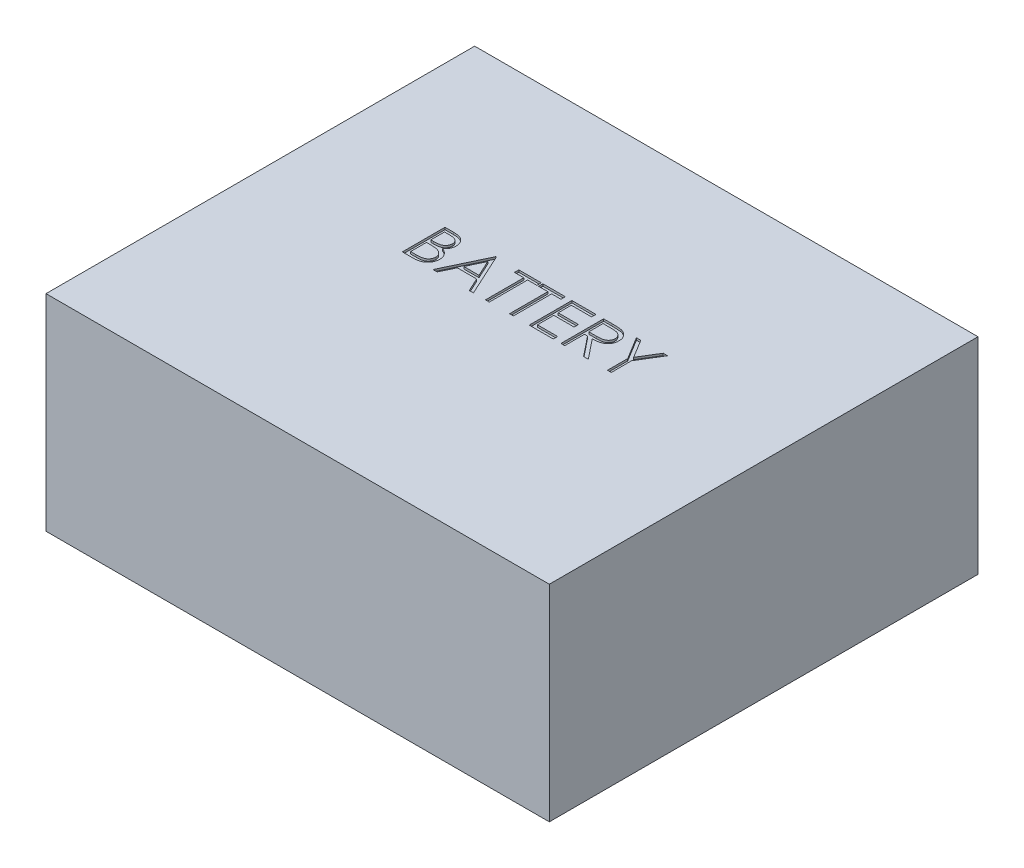
from build123d import *

# Parameters (mm, degrees)
SKETCH1_W           = 236
SKETCH1_H           = 201
BOSS_EXTRUDE1_DEPTH = 96.5
CUT_EXTRUDE1_DEPTH  = 1


with BuildPart() as part:
    # Sketch1 → Boss-Extrude1 (new body)
    with BuildSketch(Plane(origin=(0, 0, 0), x_dir=(1, 0, 0), z_dir=(0, 1, 0))):
        with Locations((118, 100.5)):
            Rectangle(SKETCH1_W, SKETCH1_H)
    extrude(amount=BOSS_EXTRUDE1_DEPTH)

    # Sketch2 → Cut-Extrude1 (cut)
    # profile 1 of 7: a face of its own
    with BuildSketch(Plane(origin=(0, 96.5, 0), x_dir=(1, 0, 0), z_dir=(0, 1, 0))):
        with BuildLine():
            Line((66.58974359, 120.5), (70.491987179, 120.5))
            add(Edge.make_bspline(
                [(70.491987179, 120.5), (70.683007055, 120.498995712), (71.053251114, 120.497049152), (71.591647924, 120.466859831), (72.095926842, 120.425696003), (72.566234113, 120.360381188), (73.002352412, 120.281571033), (73.405596054, 120.186132084), (73.774682752, 120.071694292), (74.21532696, 119.889715542), (74.717730737, 119.619297437), (75.261721552, 119.219705636), (75.726888634, 118.730948704), (76.127953304, 118.179619244), (76.446816845, 117.57312912), (76.677498544, 116.925933755), (76.823543546, 116.246380945), (76.83856317, 115.779848499), (76.846153846, 115.544070513)],
                knots=[0, 0, 0, 0, 1.001505555, 1.941167018, 2.826882275, 3.653841531, 4.429895133, 5.150066043, 5.825578002, 6.45369114, 7.647487171, 8.808567382, 9.977351308, 11.170798116, 12.373658725, 13.556498008, 14.765093433, 16, 16, 16, 16], degree=3))
            add(Edge.make_bspline(
                [(76.846153846, 115.544070513), (76.839906884, 115.323198766), (76.827631013, 114.889164955), (76.710243817, 114.254341473), (76.526468569, 113.650048794), (76.271010002, 113.078492306), (75.938998595, 112.552585945), (75.545522489, 112.068087282), (75.070797903, 111.645509813), (74.715122246, 111.409264656), (74.534455128, 111.289262821)],
                knots=[0, 0, 0, 0, 1.044552857, 2.05264487, 3.044412934, 4.028983338, 5.005914585, 5.980388656, 6.974128949, 8, 8, 8, 8], degree=3))
            add(Edge.make_bspline(
                [(74.534455128, 111.289262821), (74.761657572, 111.202034255), (75.196352128, 111.035144401), (75.794557913, 110.740084607), (76.309957028, 110.419158262), (76.746512148, 110.068690547), (77.119870176, 109.690925914), (77.445886985, 109.280325261), (77.724066266, 108.831532359), (77.962425829, 108.349226443), (78.14841872, 107.838332338), (78.287709602, 107.303642189), (78.367523598, 106.747073302), (78.378881548, 106.368299705), (78.384615385, 106.177083333)],
                knots=[0, 0, 0, 0, 1.27268992, 2.434971085, 3.483601985, 4.442670788, 5.356604649, 6.2567628, 7.179492994, 8.113709626, 9.066344395, 10.018646069, 10.999752585, 12, 12, 12, 12], degree=3))
            add(Edge.make_bspline(
                [(78.384615385, 106.177083333), (78.379033407, 105.981844064), (78.368050711, 105.597705332), (78.2870223, 105.033390277), (78.149827403, 104.494104868), (77.960849424, 103.976360967), (77.714207626, 103.481160199), (77.41404783, 103.007941547), (77.056153181, 102.561459658), (76.65579393, 102.13675324), (76.202867384, 101.75488017), (75.714205927, 101.414790417), (75.183655528, 101.135098634), (74.619929848, 100.90014994), (74.016705184, 100.720680234), (73.376690285, 100.595122669), (72.700437132, 100.510522457), (72.236381411, 100.503567001), (71.998397436, 100.5)],
                knots=[0, 0, 0, 0, 0.978564426, 1.925352924, 2.850884081, 3.763762016, 4.682927383, 5.618979971, 6.567305752, 7.547517671, 8.540179244, 9.531824382, 10.526200242, 11.540722885, 12.589160233, 13.674978461, 14.80764778, 16, 16, 16, 16], degree=3))
            Line((71.998397436, 100.5), (66.58974359, 100.5))
            Line((66.58974359, 100.5), (66.58974359, 120.5))
        make_face()
        with BuildLine():
            Line((68.384615385, 118.448717949), (68.384615385, 112.038461538))
            Line((68.384615385, 112.038461538), (69.590544872, 112.038461538))
            add(Edge.make_bspline(
                [(69.590544872, 112.038461538), (69.766823702, 112.040746813), (70.107430327, 112.045162428), (70.600686879, 112.057811097), (71.058544125, 112.093228488), (71.480211743, 112.1286357), (71.865025708, 112.186204772), (72.212133488, 112.254731189), (72.526982614, 112.327204933), (72.890065731, 112.450459143), (73.301911151, 112.632617287), (73.74095746, 112.915313494), (74.128011572, 113.252024083), (74.454852645, 113.640543865), (74.722346762, 114.068350641), (74.90813942, 114.528618529), (75.034123901, 115.009876427), (75.045504081, 115.340266443), (75.051282051, 115.508012821)],
                knots=[0, 0, 0, 0, 1.156816544, 2.235205308, 3.236616184, 4.169592532, 5.011045266, 5.787822928, 6.49130361, 7.128639758, 8.301311294, 9.436451833, 10.541879658, 11.654887649, 12.756523258, 13.837046038, 14.901820046, 16, 16, 16, 16], degree=3))
            add(Edge.make_bspline(
                [(75.051282051, 115.508012821), (75.048275307, 115.619017229), (75.042377251, 115.836764498), (74.994072665, 116.154189379), (74.911972239, 116.452725108), (74.806519135, 116.736462881), (74.659155199, 116.996530597), (74.485649695, 117.241920286), (74.276017179, 117.464275249), (74.037403964, 117.672100954), (73.763068976, 117.856355398), (73.45317588, 118.017731188), (73.103532011, 118.147678483), (72.720029982, 118.261485069), (72.296766625, 118.341418176), (71.83862632, 118.408008963), (71.341856497, 118.441910346), (70.998170197, 118.446398134), (70.820512821, 118.448717949)],
                knots=[0, 0, 0, 0, 0.91205012, 1.789085906, 2.630437955, 3.453916878, 4.269457761, 5.079663411, 5.91843418, 6.774407191, 7.675494373, 8.627863946, 9.638891023, 10.736472738, 11.911756761, 13.175263542, 14.539845004, 16, 16, 16, 16], degree=3))
            Line((70.820512821, 118.448717949), (68.384615385, 118.448717949))
        make_face(mode=Mode.SUBTRACT)
        with BuildLine():
            Line((68.384615385, 109.987179487), (68.384615385, 102.551282051))
            Line((68.384615385, 102.551282051), (70.940705128, 102.551282051))
            add(Edge.make_bspline(
                [(70.940705128, 102.551282051), (71.123670419, 102.553474894), (71.476311897, 102.557701308), (71.985461783, 102.571498763), (72.457365233, 102.602883195), (72.889868866, 102.65228805), (73.287642881, 102.705879188), (73.64591547, 102.777943651), (73.967590861, 102.86050914), (74.340586905, 102.988132981), (74.760606953, 103.186398529), (75.213240418, 103.485336966), (75.61567595, 103.841470153), (75.957420288, 104.253646805), (76.237494509, 104.701825816), (76.441239966, 105.176942102), (76.566902005, 105.671145116), (76.582114401, 106.008097759), (76.58974359, 106.177083333)],
                knots=[0, 0, 0, 0, 1.160039823, 2.235823828, 3.228722157, 4.157150951, 4.99529583, 5.772374946, 6.472645482, 7.099169577, 8.269452708, 9.405989375, 10.527446681, 11.663510218, 12.788923519, 13.866172445, 14.929861265, 16, 16, 16, 16], degree=3))
            add(Edge.make_bspline(
                [(76.58974359, 106.177083333), (76.588165851, 106.282759565), (76.585035822, 106.492407461), (76.537832308, 106.800497856), (76.469181623, 107.098931418), (76.380430572, 107.388518506), (76.251176475, 107.664023514), (76.100281932, 107.930895283), (75.923359637, 108.189486594), (75.647678689, 108.516413756), (75.24669592, 108.893082402), (74.676942918, 109.261868129), (74.029101215, 109.559284169), (73.559229827, 109.685566891), (73.31650641, 109.750801282)],
                knots=[0, 0, 0, 0, 0.723448775, 1.435228256, 2.130040452, 2.821711965, 3.505591119, 4.210454504, 4.921174351, 5.648778258, 7.137944449, 8.670945889, 10.280296675, 12, 12, 12, 12], degree=3))
            add(Edge.make_bspline(
                [(73.31650641, 109.750801282), (73.219197291, 109.770544619), (73.008211049, 109.813352246), (72.664167732, 109.858539122), (72.271391339, 109.898796607), (71.828974897, 109.928574651), (71.336358662, 109.9593549), (70.792490556, 109.971325306), (70.199591615, 109.985606793), (69.78820663, 109.986641845), (69.574519231, 109.987179487)],
                knots=[0, 0, 0, 0, 0.634451884, 1.375622551, 2.216452059, 3.157844607, 4.20941857, 5.370758133, 6.634282058, 8, 8, 8, 8], degree=3))
            Line((69.574519231, 109.987179487), (68.384615385, 109.987179487))
        make_face(mode=Mode.SUBTRACT)
    # profile 2 of 7: a face of its own
    with BuildSketch(Plane(origin=(0, 96.5, 0), x_dir=(1, 0, 0), z_dir=(0, 1, 0))):
        Polygon((90.692307692, 120.5), (99.923076923, 100.5), (97.971955128, 100.5), (95.015224359, 106.91025641), (85.948717949, 106.91025641), (82.911858974, 100.5), (80.948717949, 100.5), (90.435897436, 120.5), align=None)
        Polygon((90.544070513, 116.59775641), (86.926282051, 108.961538462), (94.069711538, 108.961538462), align=None, mode=Mode.SUBTRACT)
    # profile 3 of 7: a face of its own
    with BuildSketch(Plane(origin=(0, 96.5, 0), x_dir=(1, 0, 0), z_dir=(0, 1, 0))):
        Polygon((101.205128205, 118.448717949), (101.205128205, 120.5), (111.717948718, 120.5), (111.717948718, 118.448717949), (107.358974359, 118.448717949), (107.358974359, 100.5), (105.564102564, 100.5), (105.564102564, 118.448717949), align=None)
    # profile 4 of 7: a face of its own
    with BuildSketch(Plane(origin=(0, 96.5, 0), x_dir=(1, 0, 0), z_dir=(0, 1, 0))):
        Polygon((112.487179487, 118.448717949), (112.487179487, 120.5), (123, 120.5), (123, 118.448717949), (118.641025641, 118.448717949), (118.641025641, 100.5), (116.846153846, 100.5), (116.846153846, 118.448717949), align=None)
    # profile 5 of 7: a face of its own
    with BuildSketch(Plane(origin=(0, 96.5, 0), x_dir=(1, 0, 0), z_dir=(0, 1, 0))):
        Polygon((126.076923077, 120.5), (137.358974359, 120.5), (137.358974359, 118.448717949), (127.871794872, 118.448717949), (127.871794872, 112.294871795), (137.358974359, 112.294871795), (137.358974359, 110.243589744), (127.871794872, 110.243589744), (127.871794872, 102.551282051), (137.358974359, 102.551282051), (137.358974359, 100.5), (126.076923077, 100.5), align=None)
    # profile 6 of 7: a face of its own
    with BuildSketch(Plane(origin=(0, 96.5, 0), x_dir=(1, 0, 0), z_dir=(0, 1, 0))):
        with BuildLine():
            Line((140.948717949, 120.5), (144.951121795, 120.5))
            add(Edge.make_bspline(
                [(144.951121795, 120.5), (145.218213958, 120.499110937), (145.731060497, 120.497403838), (146.465764899, 120.487885193), (147.133348311, 120.46060316), (147.733461678, 120.43712554), (148.266093992, 120.394314447), (148.732878511, 120.353396464), (149.131665354, 120.299832688), (149.373070218, 120.250087414), (149.482371795, 120.227564103)],
                knots=[0, 0, 0, 0, 1.410062039, 2.707475311, 3.878576406, 4.937260626, 5.877586885, 6.699081471, 7.410979367, 8, 8, 8, 8], degree=3))
            add(Edge.make_bspline(
                [(149.482371795, 120.227564103), (149.628695361, 120.191411158), (149.918221015, 120.119876508), (150.335078536, 119.968678789), (150.732303244, 119.793709506), (151.108245097, 119.588202532), (151.461021047, 119.350632363), (151.794268537, 119.085100235), (152.109499757, 118.793059059), (152.393966215, 118.467145679), (152.662189367, 118.125222766), (152.88841009, 117.755487013), (153.083418546, 117.368849713), (153.238678643, 116.961378754), (153.363695634, 116.537025772), (153.451845573, 116.091946934), (153.504709503, 115.628169933), (153.510091534, 115.311839026), (153.512820513, 115.151442308)],
                knots=[0, 0, 0, 0, 1.027469482, 2.033020251, 3.019912614, 3.986113645, 4.951240523, 5.91722682, 6.890402269, 7.87763091, 8.8651537, 9.85103654, 10.82876324, 11.815024772, 12.821070561, 13.842952187, 14.906261191, 16, 16, 16, 16], degree=3))
            add(Edge.make_bspline(
                [(153.512820513, 115.151442308), (153.504426238, 114.884955996), (153.488046833, 114.364972179), (153.335331955, 113.610338571), (153.085180414, 112.90639963), (152.740475905, 112.254041699), (152.301507473, 111.665980869), (151.773937238, 111.149463981), (151.157470886, 110.717235909), (150.583589081, 110.417505597), (150.076650797, 110.225546119), (149.659317581, 110.090481211), (149.20407771, 109.986127124), (148.715292941, 109.892640657), (148.190929195, 109.822059546), (147.632243256, 109.77036472), (147.038836675, 109.73805587), (146.63118485, 109.733244414), (146.421474359, 109.730769231)],
                knots=[0, 0, 0, 0, 1.260483769, 2.459530307, 3.627416485, 4.787058657, 5.939039949, 7.08810263, 8.267026773, 9.491475466, 10.141966685, 10.831826277, 11.566392101, 12.351337768, 13.187381173, 14.07005841, 15.007169909, 16, 16, 16, 16], degree=3))
            Line((146.421474359, 109.730769231), (153.769230769, 100.5))
            Line((153.769230769, 100.5), (151.549679487, 100.5))
            Line((151.549679487, 100.5), (144.201923077, 109.730769231))
            Line((144.201923077, 109.730769231), (142.743589744, 109.730769231))
            Line((142.743589744, 109.730769231), (142.743589744, 100.5))
            Line((142.743589744, 100.5), (140.948717949, 100.5))
            Line((140.948717949, 100.5), (140.948717949, 120.5))
        make_face()
        with BuildLine():
            Line((142.743589744, 118.448717949), (142.743589744, 111.782051282))
            Line((142.743589744, 111.782051282), (146.405448718, 111.75400641))
            add(Edge.make_bspline(
                [(146.405448718, 111.75400641), (146.576420369, 111.753930772), (146.907812124, 111.753784164), (147.387244494, 111.776605743), (147.833645132, 111.802567561), (148.245306573, 111.842278107), (148.622412718, 111.89345566), (148.964775079, 111.957472713), (149.272952519, 112.032055928), (149.632372738, 112.14749379), (150.033724346, 112.330385323), (150.469904117, 112.596473887), (150.841346047, 112.931154567), (151.155162403, 113.313860031), (151.407330583, 113.734638595), (151.58511375, 114.188446419), (151.697927706, 114.663826979), (151.71123368, 114.990559024), (151.717948718, 115.155448718)],
                knots=[0, 0, 0, 0, 1.146690395, 2.22261258, 3.21895312, 4.145990853, 4.996080663, 5.770904154, 6.481378293, 7.121626537, 8.300444488, 9.431385265, 10.535395872, 11.636531494, 12.74115979, 13.810798291, 14.895190096, 16, 16, 16, 16], degree=3))
            add(Edge.make_bspline(
                [(151.717948718, 115.155448718), (151.711079455, 115.316286282), (151.697467081, 115.635007646), (151.586331261, 116.101612848), (151.398391939, 116.54199542), (151.145122008, 116.954363905), (150.836555408, 117.328682396), (150.474739336, 117.648951842), (150.069566792, 117.913234497), (149.69087423, 118.082116672), (149.352393016, 118.18565869), (149.058509244, 118.258522484), (148.726443657, 118.317062306), (148.354583894, 118.363965511), (147.944517432, 118.404279478), (147.494170854, 118.431432499), (147.00653211, 118.447511722), (146.668549646, 118.448306516), (146.493589744, 118.448717949)],
                knots=[0, 0, 0, 0, 1.101028733, 2.181837193, 3.264309656, 4.369019818, 5.486613113, 6.575447106, 7.666700264, 8.788928104, 9.402425223, 10.0903467, 10.862060571, 11.710948788, 12.657782767, 13.684531032, 14.801375019, 16, 16, 16, 16], degree=3))
            Line((146.493589744, 118.448717949), (142.743589744, 118.448717949))
        make_face(mode=Mode.SUBTRACT)
    # profile 7 of 7: a face of its own
    with BuildSketch(Plane(origin=(0, 96.5, 0), x_dir=(1, 0, 0), z_dir=(0, 1, 0))):
        Polygon((156.333333333, 120.5), (158.388621795, 120.5), (163.637019231, 111.914262821), (168.889423077, 120.5), (170.948717949, 120.5), (164.538461538, 110.007211538), (164.538461538, 100.5), (162.743589744, 100.5), (162.743589744, 110.007211538), align=None)
    extrude(amount=-CUT_EXTRUDE1_DEPTH, mode=Mode.SUBTRACT)


solid = part.part
